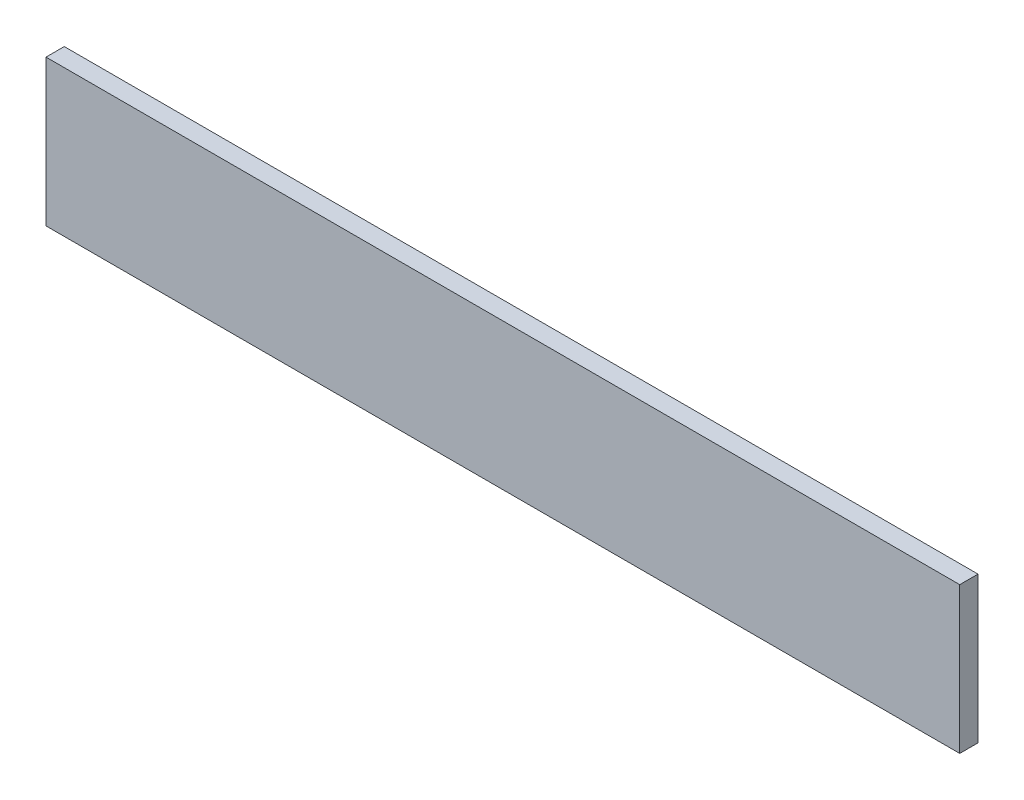
from build123d import *

# Parameters (mm, degrees)
SKETCH1_W           = 500
SKETCH1_H           = 80
BOSS_EXTRUDE1_DEPTH = 10


with BuildPart() as part:
    # Sketch1 → Boss-Extrude1 (new body)
    with BuildSketch(Plane.XY):
        Rectangle(SKETCH1_W, SKETCH1_H)
    extrude(amount=BOSS_EXTRUDE1_DEPTH)


solid = part.part
